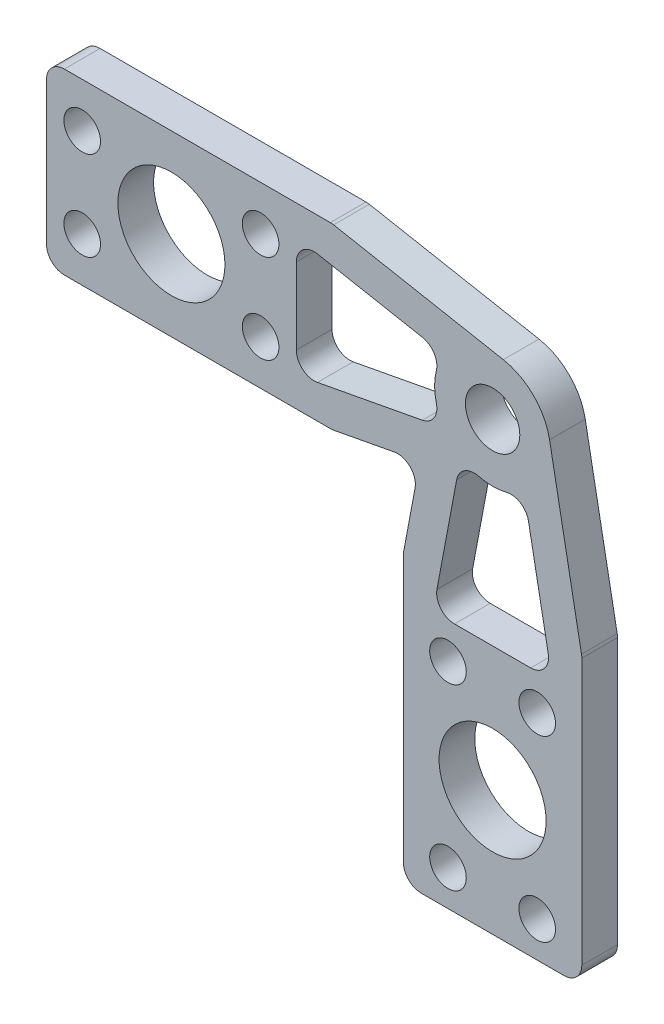
from build123d import *

# Parameters (mm, degrees)
EXTRUDE_1_DEPTH         = 3
SKETCH_2_R              = 2.05
CUT_EXTRUDE_1_DEPTH     = 10
CUT_EXTRUDE_2_DEPTH     = 10
SKETCH_4_R              = 3.05
CUT_EXTRUDE_3_DEPTH     = 10
SKETCH_5_W              = 14
SKETCH_5_H              = 10
SKETCH_5_W_2            = 10
SKETCH_5_H_2            = 14
CUT_EXTRUDE_4_DEPTH     = 10
FILLET_1_R              = 2
FILLET_2_R              = 2
MOVE_START              = 3
MOVE_FACE_1_OUTLINE_R   = 2.05
MOVE_FACE_1_OUTLINE_R_2 = 3.05
MOVE_FACE_1_DEPTH       = 1
SKETCH_9_W              = 14
SKETCH_9_H              = 10
SKETCH_9_W_2            = 10
SKETCH_9_H_2            = 14
EXTRUDE_2_DEPTH         = 4
SKETCH_14_R             = 6
SKETCH_14_R_2           = 2.05
CUT_EXTRUDE_8_DEPTH     = 10


# Read off the part's stored shape, not the designer's step: 移动面1
with BuildPart() as part:
    # 草图1 → 凸台-拉伸1 (new body)
    with BuildSketch(Plane.XY):
        Polygon((-50, 10), (10, 10), (10, -50), (-10, -50), (-10, -10), (-50, -10), align=None)
    extrude(amount=EXTRUDE_1_DEPTH)

    # 草图2 → 切除-拉伸1 (cut)
    with BuildSketch(Plane.XY.offset(3)):
        with Locations((-26, -5)):
            Circle(SKETCH_2_R)
        with Locations((-46, 5)):
            Circle(SKETCH_2_R)
        with Locations((-46, -5)):
            Circle(SKETCH_2_R)
        with Locations((-26, 5)):
            Circle(SKETCH_2_R)
        with Locations((5, -26)):
            Circle(SKETCH_2_R)
        with Locations((-5, -46)):
            Circle(SKETCH_2_R)
        with Locations((5, -46)):
            Circle(SKETCH_2_R)
        with Locations((-5, -26)):
            Circle(SKETCH_2_R)
    extrude(amount=-CUT_EXTRUDE_1_DEPTH, mode=Mode.SUBTRACT)

    # 草图3 → 切除-拉伸2 (cut)
    with BuildSketch(Plane.XY.offset(3)):
        with BuildLine():
            Line((-18, 10), (1.20164514, 6.387961252))
            ThreePointArc((1.20164514, 6.387961252), (4.596194078, 4.596194078), (6.387961252, 1.20164514))
            Line((6.387961252, 1.20164514), (10, -18))
            Line((10, -18), (10, 10))
            Line((10, 10), (-18, 10))
        make_face()
        Polygon((-18, -10), (-8.146437488, -8.146437488), (-10, -18), align=None)
    extrude(amount=-CUT_EXTRUDE_2_DEPTH, mode=Mode.SUBTRACT)

    # 草图4 → 切除-拉伸3 (cut)
    with BuildSketch(Plane.XY.offset(3)):
        Circle(SKETCH_4_R)
    extrude(amount=-CUT_EXTRUDE_3_DEPTH, mode=Mode.SUBTRACT)

    # 草图5 → 切除-拉伸4 (cut)
    with BuildSketch(Plane.XY.offset(3)):
        with Locations((-36, 0)):
            Rectangle(SKETCH_5_W, SKETCH_5_H)
        with BuildLine():
            Line((-22, 6.682287415), (-22, -6.682287415))
            Line((-22, -6.682287415), (-5.43440841, -3.566119072))
            ThreePointArc((-5.43440841, -3.566119072), (-6.5, 0), (-5.43440841, 3.566119072))
            Line((-5.43440841, 3.566119072), (-22, 6.682287415))
        make_face()
        with BuildLine():
            Line((3.566119072, -5.43440841), (6.682287415, -22))
            Line((6.682287415, -22), (-6.682287415, -22))
            Line((-6.682287415, -22), (-3.566119072, -5.43440841))
            ThreePointArc((-3.566119072, -5.43440841), (0, -6.5), (3.566119072, -5.43440841))
        make_face()
        with Locations((0, -36)):
            Rectangle(SKETCH_5_W_2, SKETCH_5_H_2)
    extrude(amount=-CUT_EXTRUDE_4_DEPTH, mode=Mode.SUBTRACT)

    # 圆角1
    fillet_1_edges = [part.edges().sort_by_distance(p)[0] for p in [
        (-29, 5, 1.5),
        (-29, -5, 1.5),
        (-43, -5, 1.5),
        (-43, 5, 1.5),
        (-3.566119072, -5.43440841, 1.5),
        (3.566119072, -5.43440841, 1.5),
        (6.682287415, -22, 1.5),
        (-6.682287415, -22, 1.5),
        (5, -43, 1.5),
        (-5, -43, 1.5),
        (-5, -29, 1.5),
        (5, -29, 1.5),
        (-22, 6.682287415, 1.5),
        (-5.43440841, 3.566119072, 1.5),
        (-5.43440841, -3.566119072, 1.5),
        (-22, -6.682287415, 1.5),
    ]]
    fillet(fillet_1_edges, radius=FILLET_1_R)

    # 圆角2
    fillet_2_edges = [part.edges().sort_by_distance(p)[0] for p in [
        (-50, 10, 1.5),
        (10, -50, 1.5),
        (-10, -50, 1.5),
        (-50, -10, 1.5),
        (-18, -10, 1.5),
        (-8.146437488, -8.146437488, 1.5),
        (-10, -18, 1.5),
        (-18, 10, 1.5),
        (10, -18, 1.5),
    ]]
    fillet(fillet_2_edges, radius=FILLET_2_R)

    # Move Face 1 outline → Move Face 1 (add)
    with BuildSketch(Plane.XY.offset(MOVE_START)):
        with BuildLine():
            Line((-50, 8), (-50, -8))
            ThreePointArc((-50, -8), (-49.414213562, -9.414213562), (-48, -10))
            Line((-48, -10), (-18.186475598, -10))
            ThreePointArc((-18.186475598, -10), (-18.000805296, -9.991362985), (-17.816738632, -9.965526539))
            Line((-17.816738632, -9.965526539), (-11.022770604, -8.687507099))
            ThreePointArc((-11.022770604, -8.687507099), (-9.238820076, -9.238820076), (-8.687507099, -11.022770604))
            Line((-8.687507099, -11.022770604), (-9.965526539, -17.816738632))
            ThreePointArc((-9.965526539, -17.816738632), (-9.991362985, -18.000805296), (-10, -18.186475598))
            Line((-10, -18.186475598), (-10, -48))
            ThreePointArc((-10, -48), (-9.414213562, -49.414213562), (-8, -50))
            Line((-8, -50), (8, -50))
            ThreePointArc((8, -50), (9.414213562, -49.414213562), (10, -48))
            Line((10, -48), (10, -18.186475598))
            ThreePointArc((10, -18.186475598), (9.991362985, -18.000805296), (9.965526539, -17.816738632))
            Line((9.965526539, -17.816738632), (6.387961252, 1.20164514))
            ThreePointArc((6.387961252, 1.20164514), (4.596194078, 4.596194078), (1.20164514, 6.387961252))
            Line((1.20164514, 6.387961252), (-17.816738632, 9.965526539))
            ThreePointArc((-17.816738632, 9.965526539), (-18.000805296, 9.991362985), (-18.186475598, 10))
            Line((-18.186475598, 10), (-48, 10))
            ThreePointArc((-48, 10), (-49.414213562, 9.414213562), (-50, 8))
        make_face()
        with Locations((-5, -46)):
            Circle(MOVE_FACE_1_OUTLINE_R, mode=Mode.SUBTRACT)
        with Locations((5, -46)):
            Circle(MOVE_FACE_1_OUTLINE_R, mode=Mode.SUBTRACT)
        with BuildLine():
            Line((3, -43), (-3, -43))
            ThreePointArc((-3, -43), (-4.414213562, -42.414213562), (-5, -41))
            Line((-5, -41), (-5, -31))
            ThreePointArc((-5, -31), (-4.414213562, -29.585786438), (-3, -29))
            Line((-3, -29), (3, -29))
            ThreePointArc((3, -29), (4.414213562, -29.585786438), (5, -31))
            Line((5, -31), (5, -41))
            ThreePointArc((5, -41), (4.414213562, -42.414213562), (3, -43))
        make_face(mode=Mode.SUBTRACT)
        with Locations((-5, -26)):
            Circle(MOVE_FACE_1_OUTLINE_R, mode=Mode.SUBTRACT)
        with Locations((5, -26)):
            Circle(MOVE_FACE_1_OUTLINE_R, mode=Mode.SUBTRACT)
        with Locations((-46, -5)):
            Circle(MOVE_FACE_1_OUTLINE_R, mode=Mode.SUBTRACT)
        with BuildLine():
            Line((-29, 3), (-29, -3))
            ThreePointArc((-29, -3), (-29.585786438, -4.414213562), (-31, -5))
            Line((-31, -5), (-41, -5))
            ThreePointArc((-41, -5), (-42.414213562, -4.414213562), (-43, -3))
            Line((-43, -3), (-43, 3))
            ThreePointArc((-43, 3), (-42.414213562, 4.414213562), (-41, 5))
            Line((-41, 5), (-31, 5))
            ThreePointArc((-31, 5), (-29.585786438, 4.414213562), (-29, 3))
        make_face(mode=Mode.SUBTRACT)
        with Locations((-46, 5)):
            Circle(MOVE_FACE_1_OUTLINE_R, mode=Mode.SUBTRACT)
        with Locations((-26, -5)):
            Circle(MOVE_FACE_1_OUTLINE_R, mode=Mode.SUBTRACT)
        with Locations((-26, 5)):
            Circle(MOVE_FACE_1_OUTLINE_R, mode=Mode.SUBTRACT)
        with BuildLine():
            ThreePointArc((-4.02556927, -7.876851659), (-3.139359655, -6.562820535), (-1.575326794, -6.306214831))
            ThreePointArc((-1.575326794, -6.306214831), (0, -6.5), (1.575326794, -6.306214831))
            ThreePointArc((1.575326794, -6.306214831), (3.139359655, -6.562820535), (4.02556927, -7.876851659))
            Line((4.02556927, -7.876851659), (6.236514061, -19.630263034))
            ThreePointArc((6.236514061, -19.630263034), (5.810382522, -21.276817541), (4.270987522, -22))
            Line((4.270987522, -22), (-4.270987522, -22))
            ThreePointArc((-4.270987522, -22), (-5.810382522, -21.276817541), (-6.236514061, -19.630263034))
            Line((-6.236514061, -19.630263034), (-4.02556927, -7.876851659))
        make_face(mode=Mode.SUBTRACT)
        with BuildLine():
            ThreePointArc((-7.876851659, 4.02556927), (-6.562820535, 3.139359655), (-6.306214831, 1.575326794))
            ThreePointArc((-6.306214831, 1.575326794), (-6.5, 0), (-6.306214831, -1.575326794))
            ThreePointArc((-6.306214831, -1.575326794), (-6.562820535, -3.139359655), (-7.876851659, -4.02556927))
            Line((-7.876851659, -4.02556927), (-19.630263034, -6.236514061))
            ThreePointArc((-19.630263034, -6.236514061), (-21.276817541, -5.810382522), (-22, -4.270987522))
            Line((-22, -4.270987522), (-22, 4.270987522))
            ThreePointArc((-22, 4.270987522), (-21.276817541, 5.810382522), (-19.630263034, 6.236514061))
            Line((-19.630263034, 6.236514061), (-7.876851659, 4.02556927))
        make_face(mode=Mode.SUBTRACT)
        Circle(MOVE_FACE_1_OUTLINE_R_2, mode=Mode.SUBTRACT)
    extrude(amount=MOVE_FACE_1_DEPTH)

    # 草图9 → 凸台-拉伸2 (add)
    with BuildSketch(Plane.XY.offset(4)):
        with Locations((-36, 0)):
            Rectangle(SKETCH_9_W, SKETCH_9_H)
        with Locations((0, -36)):
            Rectangle(SKETCH_9_W_2, SKETCH_9_H_2)
    extrude(amount=-EXTRUDE_2_DEPTH)

    # 草图14 → 切除-拉伸8 (cut)
    with BuildSketch(Plane.XY.offset(4)):
        with Locations((0, -36)):
            Circle(SKETCH_14_R)
        with Locations((5, -26)):
            Circle(SKETCH_14_R_2)
        with Locations((-5, -26)):
            Circle(SKETCH_14_R_2)
        with Locations((-36, 0)):
            Circle(SKETCH_14_R)
    extrude(amount=-CUT_EXTRUDE_8_DEPTH, mode=Mode.SUBTRACT)


solid = part.part
